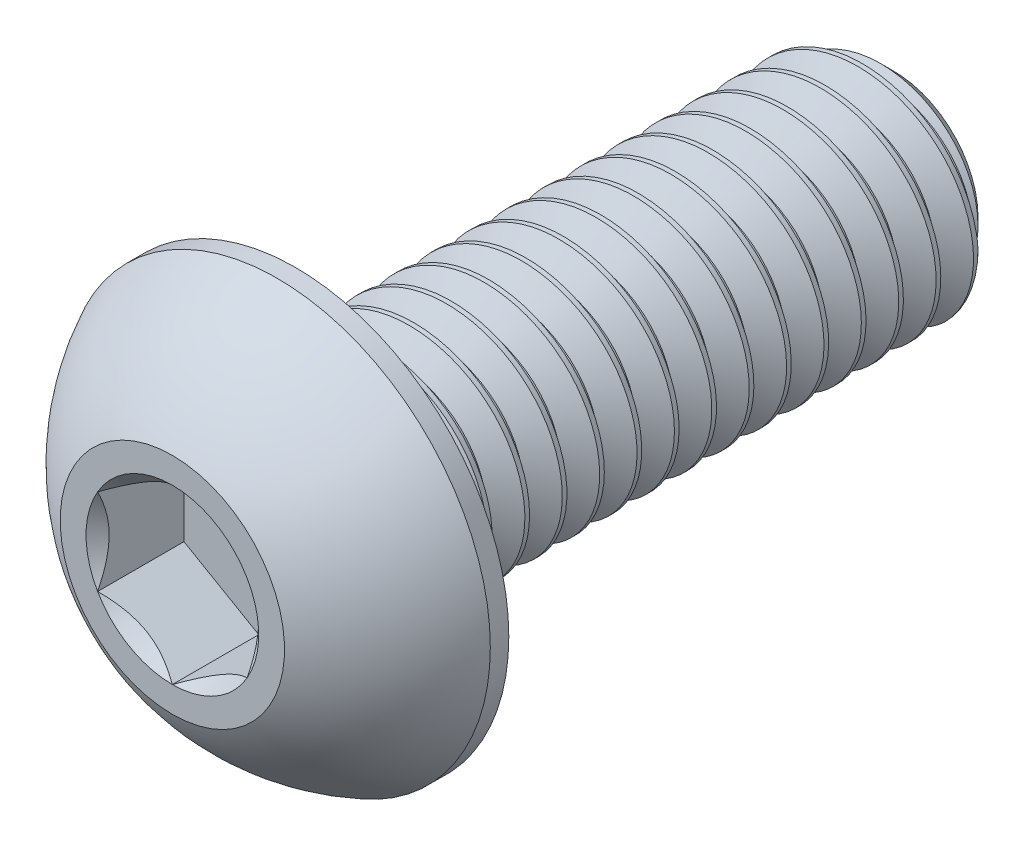
from build123d import *

# Parameters (mm, degrees)
CUT_EXTRUDE2_DEPTH = 1.155
CUT_SWEEP2_PITCH   = 0.5
CUT_SWEEP2_TO      = 8


with BuildPart() as part:
    # Sketch10 → Revolve3 (revolve)
    with BuildSketch(Plane(origin=(0, 0, 0), x_dir=(0, 0, -1), z_dir=(1, 0, 0)), mode=Mode.PRIVATE) as revolve3_sk:
        Polygon((9.275, 1.5), (9.65, 1.125), (9.65, 0), (1.65, 0), (1.65, 1.5), align=None)
    revolve(revolve3_sk.sketch.rotate(Axis((0, 0, 0), (0, 0, -1)), 90), axis=Axis((0, 0, 0), (0, 0, -1)))

    # Sketch7 → Revolve2 (revolve)
    with BuildSketch(Plane(origin=(0, 0, 0), x_dir=(0, 0, -1), z_dir=(1, 0, 0)), mode=Mode.PRIVATE) as revolve2_sk:
        with BuildLine():
            Line((1.4025, 2.85), (1.65, 2.85))
            Line((1.65, 2.85), (1.65, 0))
            Line((1.65, 0), (0, 0))
            Line((0, 0), (0, 1.5))
            ThreePointArc((0, 1.5), (0.59512511, 2.285251969), (1.4025, 2.85))
        make_face()
    revolve(revolve2_sk.sketch.rotate(Axis((0, 0, 0), (0, 0, -1)), 180), axis=Axis((0, 0, 0), (0, 0, -1)))

    # Sketch5 → Cut-Extrude2 (cut)
    with BuildSketch(Plane.XY):
        Polygon((1, -0.577350269), (1, 0.577350269), (0, 1.154700538), (-1, 0.577350269), (-1, -0.577350269), (0, -1.154700538), align=None)
    extrude(amount=-CUT_EXTRUDE2_DEPTH, mode=Mode.SUBTRACT)

    # Cut-Extrude3 cone 1 section (through the dimple's axis) → Cut-Extrude3 (revolve, cut)
    with BuildSketch(Plane(origin=(0, 0, 0), x_dir=(0, -1, 0), z_dir=(1, 0, 0))):
        Polygon((0, 0), (1.154700538, 0), (0, 1.154700538), align=None)
    revolve(axis=Axis((0, 0, 0), (0, 0, -1)), mode=Mode.SUBTRACT)


with BuildPart() as body_2:
    # Split1: read off the stored shape, not the designer's step
    # Split1: the piece on the far side of the plane
    add(part.part)
    split(bisect_by=Plane.XY.offset(-1.65), keep=Keep.BOTTOM)

    # Cut-Sweep2: arcs per turn and ends read off the stored shape
    # Cut-Sweep2: the profile of Sketch12 screwed along a right-hand helix through 21 turns, 6 arcs to a turn; built about Z, then put on its axis
    cut_sweep2_z = Axis((0, 0, 0), (0, 0, 1))
    cut_sweep2_corners = [(1.175240474, 0, -0.1875), (1.175240474, 0, -0.25), (1.527063294, 0, -0.453125), (1.527063294, 0, 0.015625)]
    with BuildLine(mode=Mode.PRIVATE) as cut_sweep2_profile:
        Line(cut_sweep2_corners[0], cut_sweep2_corners[1])
        Line(cut_sweep2_corners[1], cut_sweep2_corners[2])
        Line(cut_sweep2_corners[2], cut_sweep2_corners[3])
        Line(cut_sweep2_corners[3], cut_sweep2_corners[0])
    cut_sweep2_cap = Face(cut_sweep2_profile.wire())
    cut_sweep2_turn_angles = [0, 30, 60, 90, 120, 150, 180, 210, 240, 270, 300, 330, 360]
    cut_sweep2_turn_weights = [1, 0.8660254037844387, 1, 0.8660254037844387, 1, 0.8660254037844387, 1, 0.8660254037844387, 1, 0.8660254037844387, 1, 0.8660254037844387, 1]
    cut_sweep2_turn_rails = [Edge.make_bspline([Vector(p[0], p[1], 0).rotate(cut_sweep2_z, cut_sweep2_turn_angles[k]) / cut_sweep2_turn_weights[k] + Vector(0, 0, p[2] + CUT_SWEEP2_PITCH * cut_sweep2_turn_angles[k] / 360) for k in range(13)], [0, 0, 0, 1, 1, 2, 2, 3, 3, 4, 4, 5, 5, 6, 6, 6], 2, cut_sweep2_turn_weights) for p in cut_sweep2_corners]
    cut_sweep2_turn_sides = [Face.make_surface_from_curves(cut_sweep2_turn_rails[p[0]], cut_sweep2_turn_rails[p[1]]) for p in [(0, 1), (1, 2), (2, 3), (3, 0)]]
    cut_sweep2 = Plane(origin=(0, 0, -9.65), x_dir=(0, 1, 0), z_dir=(0, 0, 1)) * split(Solid(Shell([*[p.moved(Location((0, 0, CUT_SWEEP2_PITCH * i))) for i in range(21) for p in cut_sweep2_turn_sides], cut_sweep2_cap, cut_sweep2_cap.rotate(cut_sweep2_z, 7560).moved(Location((0, 0, CUT_SWEEP2_PITCH * 7560 / 360)))])), bisect_by=Plane.XY.offset(CUT_SWEEP2_TO), keep=Keep.BOTTOM, mode=Mode.PRIVATE)
    add(cut_sweep2, mode=Mode.SUBTRACT)


with BuildPart() as part_1:
    add(part.part)

    # Split1
    split(bisect_by=Plane.XY.offset(-1.65), keep=Keep.TOP)

    add(body_2.part)  # Boss-Extrude1 merges body 2
    # Boss-Extrude1: read off the stored shape, not the designer's step
    # Boss-Extrude1 outline → Boss-Extrude1 (revolve)
    with BuildSketch(Plane.XZ):
        Polygon((1.175240474, -1.65), (1.175240474, -1.974759526), (1.5, -1.65), align=None)
    revolve(axis=Axis((0, 0, 0), (0, 0, 1)))


solid = part_1.part
